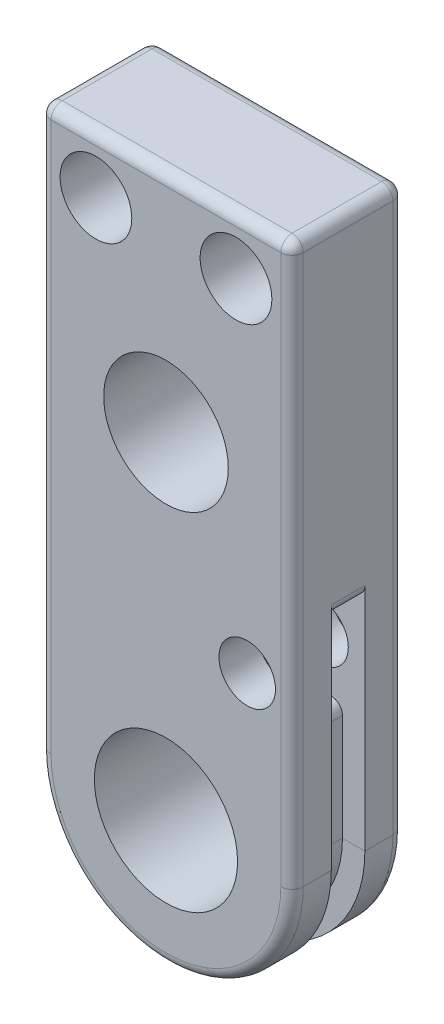
from build123d import *

# Parameters (mm, degrees)
SKETCH1_R           = 4.05765
SKETCH1_R_2         = 3.5306
SKETCH1_R_3         = 2.032
SKETCH1_R_4         = 1.6002
BOSS_EXTRUDE1_DEPTH = 3.175
SKETCH1_7_R         = 1.6002
CUT_EXTRUDE4_DEPTH  = 0.9525
SKETCH3_W           = 1.27
SKETCH3_H           = 1.905
FILLET1_R           = 0.635
FILLET2_R           = 0.635


with BuildPart() as part:
    # Sketch1 → Boss-Extrude1 (new, symmetric)
    with BuildSketch(Plane.XY):
        with BuildLine():
            Line((7.14375, 31.75), (7.14375, 0))
            ThreePointArc((7.14375, 0), (0, -7.14375), (-7.14375, 0))
            Line((-7.14375, 0), (-7.14375, 31.75))
            Line((-7.14375, 31.75), (7.14375, 31.75))
        make_face()
        Circle(SKETCH1_R, mode=Mode.SUBTRACT)
        with Locations((0, 19.05)):
            Circle(SKETCH1_R_2, mode=Mode.SUBTRACT)
        with Locations((-3.96875, 28.575)):
            Circle(SKETCH1_R_3, mode=Mode.SUBTRACT)
        with Locations((3.96875, 28.575)):
            Circle(SKETCH1_R_3, mode=Mode.SUBTRACT)
        with Locations((4.60375, 9.525)):
            Circle(SKETCH1_R_4, mode=Mode.SUBTRACT)
    extrude(amount=BOSS_EXTRUDE1_DEPTH, both=True)

    # Sketch1<7> → Cut-Extrude4 (cut, symmetric)
    with BuildSketch(Plane.XY):
        with BuildLine():
            Line((7.14375, 6.6548), (7.14375, 12.3952))
            Line((7.14375, 12.3952), (4.60375, 12.3952))
            ThreePointArc((4.60375, 12.3952), (1.73355, 9.525), (4.60375, 6.6548))
            Line((4.60375, 6.6548), (7.14375, 6.6548))
        make_face()
        with Locations((4.60375, 9.525)):
            Circle(SKETCH1_7_R, mode=Mode.SUBTRACT)
    extrude(amount=CUT_EXTRUDE4_DEPTH, both=True, mode=Mode.SUBTRACT)

    # Cut-Sweep1: sweep along a path in Sketch2
    with BuildLine(Plane.XY.offset(3.175)) as cut_sweep1_path:
        Line((7.14375, 6.6548), (7.14375, 0))
        ThreePointArc((7.14375, 0), (0, -7.14375), (-7.14375, 0))
        Line((-7.14375, 0), (-7.14375, 6.35))
    # Sketch3 → Cut-Sweep1 (sweep, cut)
    with BuildSketch(Plane(origin=(0, 6.6548, 0), x_dir=(1, 0, 0), z_dir=(0, 1, 0))):
        with Locations((6.50875, 0)):
            Rectangle(SKETCH3_W, SKETCH3_H)
    sweep(path=cut_sweep1_path.line, mode=Mode.SUBTRACT)

    # Fillet1
    fillet1_edges = [part.edges().sort_by_distance(p)[0] for p in [
        (0, -7.14375, 3.175),
        (-7.14375, 15.875, -3.175),
        (0, 31.75, -3.175),
        (7.14375, 15.875, 3.175),
        (7.14375, 15.875, -3.175),
        (0, -7.14375, -3.175),
        (-7.14375, 31.75, 0),
        (7.14375, 31.75, 0),
        (0, 31.75, 3.175),
        (-7.14375, 15.875, 3.175),
    ]]
    fillet(fillet1_edges, radius=FILLET1_R)

    # Fillet2
    fillet2_edges = [part.edges().sort_by_distance(p)[0] for p in [
        (5.87375, 6.6548, 0),
        (7.14375, 12.3952, 0),
        (-7.14375, 6.35, 0),
        (-5.87375, 6.35, 0),
    ]]
    fillet(fillet2_edges, radius=FILLET2_R - 0.0001)  # a hair under: the kernel refuses the full size


solid = part.part
